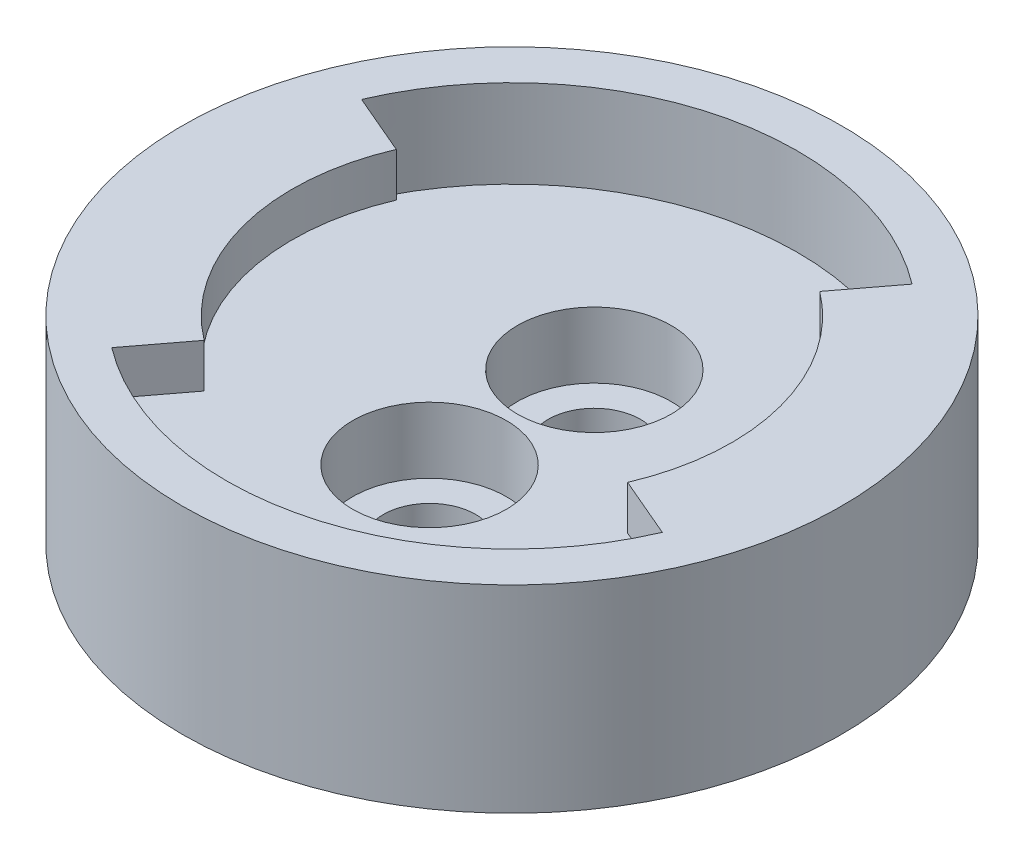
from build123d import *

# Parameters (mm, degrees)
SKIZZE1_R                       = 15
AUFSATZ_LINEAR_AUSTRAGEN1_DEPTH = 5
AUFSATZ_LINEAR_START            = 4
SKIZZE2_R                       = 15
SKIZZE2_R_2                     = 13
AUFSATZ_LINEAR_AUSTRAGEN2_DEPTH = 4
AUFSATZ_LINEAR_AUSTRAGEN3_DEPTH = 2
SKIZZE5_R                       = 3.5
SCHNITT_LINEAR_AUSTRAGEN1_DEPTH = 3
SKIZZE6_R                       = 2.1
SCHNITT_LINEAR_AUSTRAGEN2_DEPTH = 3


with BuildPart() as part:
    # Skizze1 → Aufsatz-Linear austragen1 (new body)
    with BuildSketch(Plane(origin=(0, 0, 0), x_dir=(1, 0, 0), z_dir=(0, 1, 0))):
        Circle(SKIZZE1_R)
    extrude(amount=-AUFSATZ_LINEAR_AUSTRAGEN1_DEPTH)

    # Skizze2 → Aufsatz-Linear austragen2 (add)
    with BuildSketch(Plane(origin=(0, 0, 0), x_dir=(1, 0, 0), z_dir=(0, 1, 0)).offset(AUFSATZ_LINEAR_START)):
        Circle(SKIZZE2_R)
        Circle(SKIZZE2_R_2, mode=Mode.SUBTRACT)
    extrude(amount=-AUFSATZ_LINEAR_AUSTRAGEN2_DEPTH)

    # Skizze3 → Aufsatz-Linear austragen3 (add)
    with BuildSketch(Plane(origin=(0, 4, 0), x_dir=(1, 0, 0), z_dir=(0, 1, 0))):
        with BuildLine():
            Line((-6.042078394, -7.968267609), (-7.854701912, -10.358747891))
            ThreePointArc((-7.854701912, -10.358747891), (-12.566291217, -3.329913671), (-11.953670509, 5.109771166))
            Line((-11.953670509, 5.109771166), (-9.195131161, 3.930593205))
            ThreePointArc((-9.195131161, 3.930593205), (-9.666377859, -2.561472055), (-6.042078394, -7.968267609))
        make_face()
        with BuildLine():
            Line((6.042078394, 7.968267609), (7.854701912, 10.358747891))
            ThreePointArc((7.854701912, 10.358747891), (12.566291217, 3.329913671), (11.953670509, -5.109771166))
            Line((11.953670509, -5.109771166), (9.195131161, -3.930593205))
            ThreePointArc((9.195131161, -3.930593205), (9.666377859, 2.561472055), (6.042078394, 7.968267609))
        make_face()
    extrude(amount=-AUFSATZ_LINEAR_AUSTRAGEN3_DEPTH)

    # Skizze5 → Schnitt-Linear austragen1 (cut)
    with BuildSketch(Plane(origin=(0, 0, 0), x_dir=(1, 0, 0), z_dir=(0, 1, 0))):
        with Locations((0, 3.75)):
            Circle(SKIZZE5_R)
        with Locations((0, -3.75)):
            Circle(SKIZZE5_R)
    extrude(amount=-SCHNITT_LINEAR_AUSTRAGEN1_DEPTH, mode=Mode.SUBTRACT)

    # Skizze6 → Schnitt-Linear austragen2 (cut)
    with BuildSketch(Plane(origin=(0, -3, 0), x_dir=(1, 0, 0), z_dir=(0, 1, 0))):
        with Locations((0, 3.75)):
            Circle(SKIZZE6_R)
        with Locations((0, -3.75)):
            Circle(SKIZZE6_R)
    extrude(amount=-SCHNITT_LINEAR_AUSTRAGEN2_DEPTH, mode=Mode.SUBTRACT)


solid = part.part
